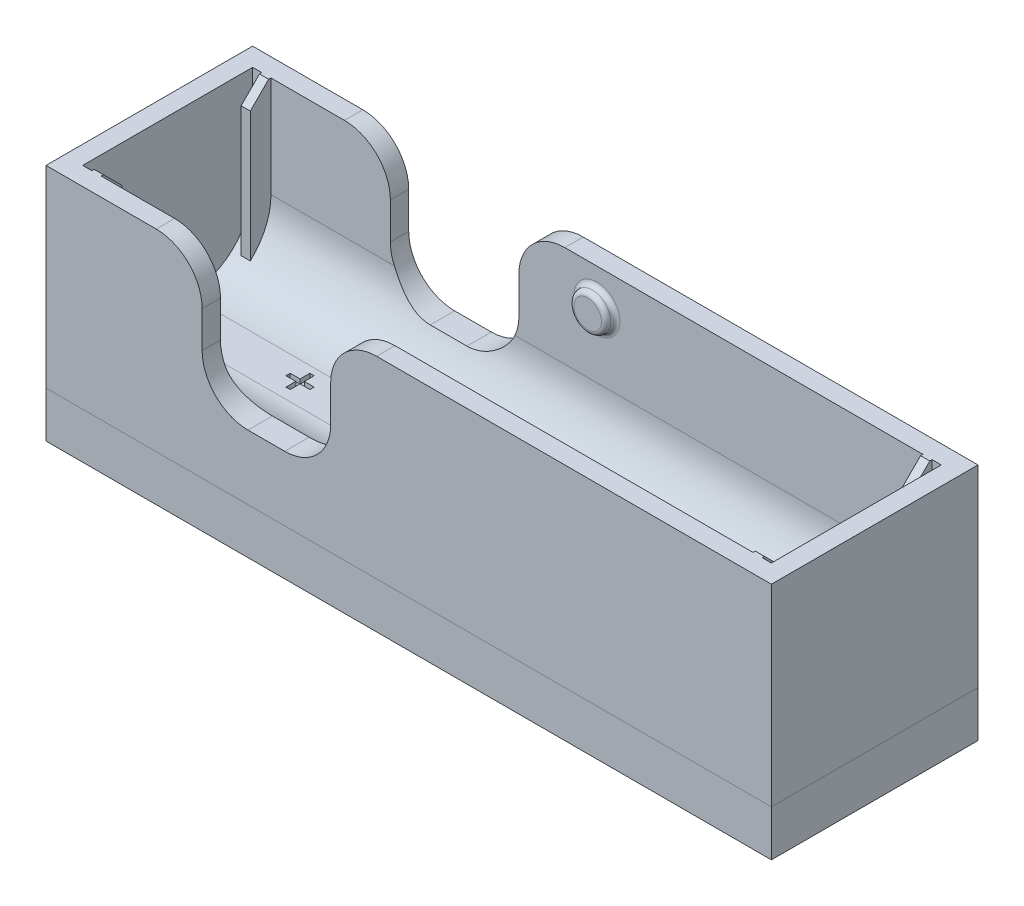
from build123d import *
from OCP.BRepAlgoAPI import BRepAlgoAPI_Cut
from OCP.TopTools import TopTools_ListOfShape

# Parameters (mm, degrees)
SKETCH_1_W          = 79
SKETCH_1_H          = 22.5
SKETCH_1_W_2        = 75
SKETCH_1_H_2        = 18.5
SKETCH_1_W_3        = 1
SKETCH_1_H_3        = 2.25
EXTRUDE_1_DEPTH     = 18
SKETCH_1_4_W        = 79
SKETCH_1_4_H        = 22.5
SKETCH_1_4_W_2      = 75
SKETCH_1_4_H_2      = 18.5
SKETCH_1_4_W_3      = 1
SKETCH_1_4_H_3      = 2.25
EXTRUDE_2_DEPTH     = 3
FILLET_1_R          = 7
CUT_EXTRUDE_1_DEPTH = 0.5
CUT_EXTRUDE_2_DEPTH = 30.5
CHAMFER_1_SIZE      = 2
SKETCH_4_R          = 2
EXTRUDE_4_DEPTH     = 1
EXTRUDE_START       = 1
SKETCH_5_R          = 2
EXTRUDE_5_DEPTH     = 1
FILLET_3_R          = 0.5
SKETCH_6_R          = 0.5
SKETCH_6_W          = 69
SKETCH_6_H          = 2
EXTRUDE_6_DEPTH     = 5
SKETCH_6_3_R        = 0.5
CUT_EXTRUDE_3_DEPTH = 3


with BuildPart() as part:
    # Эскиз1 → Бобышка-Вытянуть1 (new body)
    # profile 1 of 5: a face of its own
    with BuildSketch(Plane(origin=(0, 0, 0), x_dir=(1, 0, 0), z_dir=(0, 1, 0))):
        Rectangle(SKETCH_1_W, SKETCH_1_H)
        Rectangle(SKETCH_1_W_2, SKETCH_1_H_2, mode=Mode.SUBTRACT)
    # profile 2 of 5: a face of its own
    with BuildSketch(Plane(origin=(0, 0, 0), x_dir=(1, 0, 0), z_dir=(0, 1, 0))):
        with Locations((-36, 8.125)):
            Rectangle(SKETCH_1_W_3, SKETCH_1_H_3)
    # profile 3 of 5: a face of its own
    with BuildSketch(Plane(origin=(0, 0, 0), x_dir=(1, 0, 0), z_dir=(0, 1, 0))):
        with Locations((-36, -8.125)):
            Rectangle(SKETCH_1_W_3, SKETCH_1_H_3)
    # profile 4 of 5: a face of its own
    with BuildSketch(Plane(origin=(0, 0, 0), x_dir=(1, 0, 0), z_dir=(0, 1, 0))):
        with Locations((36, 8.125)):
            Rectangle(SKETCH_1_W_3, SKETCH_1_H_3)
    # profile 5 of 5: a face of its own
    with BuildSketch(Plane(origin=(0, 0, 0), x_dir=(1, 0, 0), z_dir=(0, 1, 0))):
        with Locations((36, -8.125)):
            Rectangle(SKETCH_1_W_3, SKETCH_1_H_3)
    extrude(amount=EXTRUDE_1_DEPTH)

    # Эскиз1<4> → Бобышка-Вытянуть2 (add)
    # profile 1 of 6: a face of its own
    with BuildSketch(Plane(origin=(0, 0, 0), x_dir=(1, 0, 0), z_dir=(0, 1, 0))):
        Rectangle(SKETCH_1_4_W, SKETCH_1_4_H)
        Rectangle(SKETCH_1_4_W_2, SKETCH_1_4_H_2, mode=Mode.SUBTRACT)
    # profile 2 of 6: a face of its own
    with BuildSketch(Plane(origin=(0, 0, 0), x_dir=(1, 0, 0), z_dir=(0, 1, 0))):
        Polygon((37.5, 9.25), (36.5, 9.25), (36.5, 7), (35.5, 7), (35.5, 9.25), (-35.5, 9.25), (-35.5, 7), (-36.5, 7), (-36.5, 9.25), (-37.5, 9.25), (-37.5, 2.5), (-36.5, 2.5), (-36.5, -2.5), (-37.5, -2.5), (-37.5, -9.25), (-36.5, -9.25), (-36.5, -7), (-35.5, -7), (-35.5, -9.25), (35.5, -9.25), (35.5, -7), (36.5, -7), (36.5, -9.25), (37.5, -9.25), (37.5, -2.5), (36.5, -2.5), (36.5, 2.5), (37.5, 2.5), align=None)
    # profile 3 of 6: a face of its own
    with BuildSketch(Plane(origin=(0, 0, 0), x_dir=(1, 0, 0), z_dir=(0, 1, 0))):
        with Locations((-36, -8.125)):
            Rectangle(SKETCH_1_4_W_3, SKETCH_1_4_H_3)
    # profile 4 of 6: a face of its own
    with BuildSketch(Plane(origin=(0, 0, 0), x_dir=(1, 0, 0), z_dir=(0, 1, 0))):
        with Locations((-36, 8.125)):
            Rectangle(SKETCH_1_4_W_3, SKETCH_1_4_H_3)
    # profile 5 of 6: a face of its own
    with BuildSketch(Plane(origin=(0, 0, 0), x_dir=(1, 0, 0), z_dir=(0, 1, 0))):
        with Locations((36, -8.125)):
            Rectangle(SKETCH_1_4_W_3, SKETCH_1_4_H_3)
    # profile 6 of 6: a face of its own
    with BuildSketch(Plane(origin=(0, 0, 0), x_dir=(1, 0, 0), z_dir=(0, 1, 0))):
        with Locations((36, 8.125)):
            Rectangle(SKETCH_1_4_W_3, SKETCH_1_4_H_3)
    extrude(amount=-EXTRUDE_2_DEPTH)

    # Скругление1
    fillet_1_edges = [part.edges().sort_by_distance(p)[0] for p in [
        (0, 0, 9.25),
        (0, 0, -9.25),
    ]]
    fillet(fillet_1_edges, radius=FILLET_1_R)

    # Эскиз2 → Вырез-Вытянуть1 (cut)
    with BuildSketch(Plane(origin=(0, 0, 0), x_dir=(1, 0, 0), z_dir=(0, 1, 0))):
        Polygon((-23.524658225, -1.093721701), (-23.524658225, -0.016798624), (-24.601581301, -0.016798624), (-24.601581301, 0.444739838), (-23.524658225, 0.444739838), (-23.524658225, 1.521662915), (-23.063119763, 1.521662915), (-23.063119763, 0.444739838), (-21.986196686, 0.444739838), (-21.986196686, -0.016798624), (-23.063119763, -0.016798624), (-23.063119763, -1.093721701), align=None)
        Polygon((21.319165068, 0.568041922), (22.806344555, 0.568041922), (22.652498401, -0.201188847), (21.165318914, -0.201188847), align=None)
    extrude(amount=-CUT_EXTRUDE_1_DEPTH, mode=Mode.SUBTRACT)


with BuildPart() as cut_extrude_2_tool:
    # Эскиз3 → Вырез-Вытянуть2 (new body)
    with BuildSketch(Plane.XY.offset(11.25)):
        with BuildLine():
            Line((-21.5, 18), (-8.5, 18))
            Line((-8.5, 18), (-3.4974587, 18))
            ThreePointArc((-3.4974587, 18), (-7.032992606, 16.535533906), (-8.4974587, 13))
            Line((-8.4974587, 13), (-8.4974587, 9.035578202))
            ThreePointArc((-8.4974587, 9.035578202), (-9.961924794, 5.500044296), (-13.4974587, 4.035578202))
            Line((-13.4974587, 4.035578202), (-17.4974587, 4.035578202))
            ThreePointArc((-17.4974587, 4.035578202), (-21.032992606, 5.500044296), (-22.4974587, 9.035578202))
            Line((-22.4974587, 9.035578202), (-22.4974587, 13.000000646))
            ThreePointArc((-22.4974587, 13.000000646), (-23.962823393, 16.536432923), (-27.5, 18))
            Line((-27.5, 18), (-21.5, 18))
        make_face()
    extrude(amount=-CUT_EXTRUDE_2_DEPTH)


with BuildPart() as part_1:
    add(part.part)

    # Вырез-Вытянуть2: cut by cut_extrude_2_tool, with a tolerance
    cut_extrude_2_stock = TopTools_ListOfShape()
    cut_extrude_2_stock.Append(part_1.part.wrapped)
    cut_extrude_2_tools = TopTools_ListOfShape()
    cut_extrude_2_tools.Append(cut_extrude_2_tool.part.wrapped)
    cut_extrude_2_cut = BRepAlgoAPI_Cut()
    cut_extrude_2_cut.SetArguments(cut_extrude_2_stock)
    cut_extrude_2_cut.SetTools(cut_extrude_2_tools)
    cut_extrude_2_cut.SetFuzzyValue(0.00001)
    cut_extrude_2_cut.Build()
    add(Compound.cast(cut_extrude_2_cut.Shape()).solids(), mode=Mode.REPLACE)

    # Фаска1
    chamfer_1_edges = [part_1.edges().sort_by_distance(p)[0] for p in [
        (36, 18, -7),
        (36, 18, 7),
        (-36, 18, 7),
        (-36, 18, -7),
    ]]
    chamfer(chamfer_1_edges, length=CHAMFER_1_SIZE)

    # Эскиз4 → Бобышка-Вытянуть4 (add)
    with BuildSketch(Plane(origin=(0, 0, 9.25), x_dir=(-1, 0, 0), z_dir=(0, 0, -1))):
        with Locations((0, 14)):
            Circle(SKETCH_4_R)
    extrude(amount=EXTRUDE_4_DEPTH)

    # Эскиз5 → Бобышка-Вытянуть5 (add)
    with BuildSketch(Plane.XY.offset(-9.25).offset(EXTRUDE_START)):
        with Locations(Location((0, 14, 0), (0, 0, 180))):
            Circle(SKETCH_5_R)
    extrude(amount=-EXTRUDE_5_DEPTH)

    # Скругление3
    fillet_3_edges = [part_1.edges().sort_by_distance(p)[0] for p in [
        (2, 14, 9.25),
        (2, 14, 8.25),
        (2, 14, -9.25),
        (2, 14, -8.25),
    ]]
    fillet(fillet_3_edges, radius=FILLET_3_R - 0.0001)  # a hair under: the kernel refuses the full size

    # Эскиз6<3> → Вырез-Вытянуть3 (cut)
    with BuildSketch(Plane.XZ.offset(3)):
        with Locations(Location((-37, -8.75, 0), (0, 0, 270))):
            Circle(SKETCH_6_3_R)
        with Locations(Location((-37, 8.75, 0), (0, 0, 270))):
            Circle(SKETCH_6_3_R)
        with Locations(Location((37, -8.75, 0), (0, 0, 270))):
            Circle(SKETCH_6_3_R)
        with Locations(Location((37, 8.75, 0), (0, 0, 270))):
            Circle(SKETCH_6_3_R)
    extrude(amount=-CUT_EXTRUDE_3_DEPTH, mode=Mode.SUBTRACT)


with BuildPart() as body_2:
    # Эскиз6 → Бобышка-Вытянуть6 (new body)
    # profile 1 of 8: a face of its own
    with BuildSketch(Plane.XZ.offset(3)):
        with BuildLine():
            Line((-39.5, 6.25), (-37.5, 6.25))
            Line((-37.5, 6.25), (-36.5, 6.25))
            ThreePointArc((-36.5, 6.25), (-35.085786438, 6.835786438), (-34.5, 8.25))
            Line((-34.5, 8.25), (-34.5, 9.25))
            Line((-34.5, 9.25), (-34.5, 11.25))
            Line((-34.5, 11.25), (-39.5, 11.25))
            Line((-39.5, 11.25), (-39.5, 6.25))
        make_face()
        with Locations(Location((-37, 8.75, 0), (0, 0, 270))):
            Circle(SKETCH_6_R, mode=Mode.SUBTRACT)
    # profile 2 of 8: a face of its own
    with BuildSketch(Plane.XZ.offset(3)):
        with Locations((0, 10.25)):
            Rectangle(SKETCH_6_W, SKETCH_6_H)
    # profile 3 of 8: a face of its own
    with BuildSketch(Plane.XZ.offset(3)):
        Polygon((-37.5, 2.5), (-37.5, 6.25), (-39.5, 6.25), (-39.5, -6.25), (-37.5, -6.25), (-37.5, -2.5), align=None)
    # profile 4 of 8: a face of its own
    with BuildSketch(Plane.XZ.offset(3)):
        with BuildLine():
            Line((-37.5, -6.25), (-39.5, -6.25))
            Line((-39.5, -6.25), (-39.5, -11.25))
            Line((-39.5, -11.25), (-34.5, -11.25))
            Line((-34.5, -11.25), (-34.5, -9.25))
            Line((-34.5, -9.25), (-34.5, -8.25))
            ThreePointArc((-34.5, -8.25), (-35.085786438, -6.835786438), (-36.5, -6.25))
            Line((-36.5, -6.25), (-37.5, -6.25))
        make_face()
        with Locations(Location((-37, -8.75, 0), (0, 0, 270))):
            Circle(SKETCH_6_R, mode=Mode.SUBTRACT)
    # profile 5 of 8: a face of its own
    with BuildSketch(Plane.XZ.offset(3)):
        with Locations((0, -10.25)):
            Rectangle(SKETCH_6_W, SKETCH_6_H)
    # profile 6 of 8: a face of its own
    with BuildSketch(Plane.XZ.offset(3)):
        with BuildLine():
            Line((39.5, 11.25), (34.5, 11.25))
            Line((34.5, 11.25), (34.5, 9.25))
            Line((34.5, 9.25), (34.5, 8.25))
            ThreePointArc((34.5, 8.25), (35.085786438, 6.835786438), (36.5, 6.25))
            Line((36.5, 6.25), (37.5, 6.25))
            Line((37.5, 6.25), (39.5, 6.25))
            Line((39.5, 6.25), (39.5, 11.25))
        make_face()
        with Locations(Location((37, 8.75, 0), (0, 0, 270))):
            Circle(SKETCH_6_R, mode=Mode.SUBTRACT)
    # profile 7 of 8: a face of its own
    with BuildSketch(Plane.XZ.offset(3)):
        Polygon((39.5, -6.25), (39.5, 6.25), (37.5, 6.25), (37.5, 2.5), (37.5, -2.5), (37.5, -6.25), align=None)
    # profile 8 of 8: a face of its own
    with BuildSketch(Plane.XZ.offset(3)):
        with BuildLine():
            Line((34.5, -9.25), (34.5, -11.25))
            Line((34.5, -11.25), (39.5, -11.25))
            Line((39.5, -11.25), (39.5, -6.25))
            Line((39.5, -6.25), (37.5, -6.25))
            Line((37.5, -6.25), (36.5, -6.25))
            ThreePointArc((36.5, -6.25), (35.085786438, -6.835786438), (34.5, -8.25))
            Line((34.5, -8.25), (34.5, -9.25))
        make_face()
        with Locations(Location((37, -8.75, 0), (0, 0, 270))):
            Circle(SKETCH_6_R, mode=Mode.SUBTRACT)
    extrude(amount=EXTRUDE_6_DEPTH)


solid = Compound([part_1.part, body_2.part])
